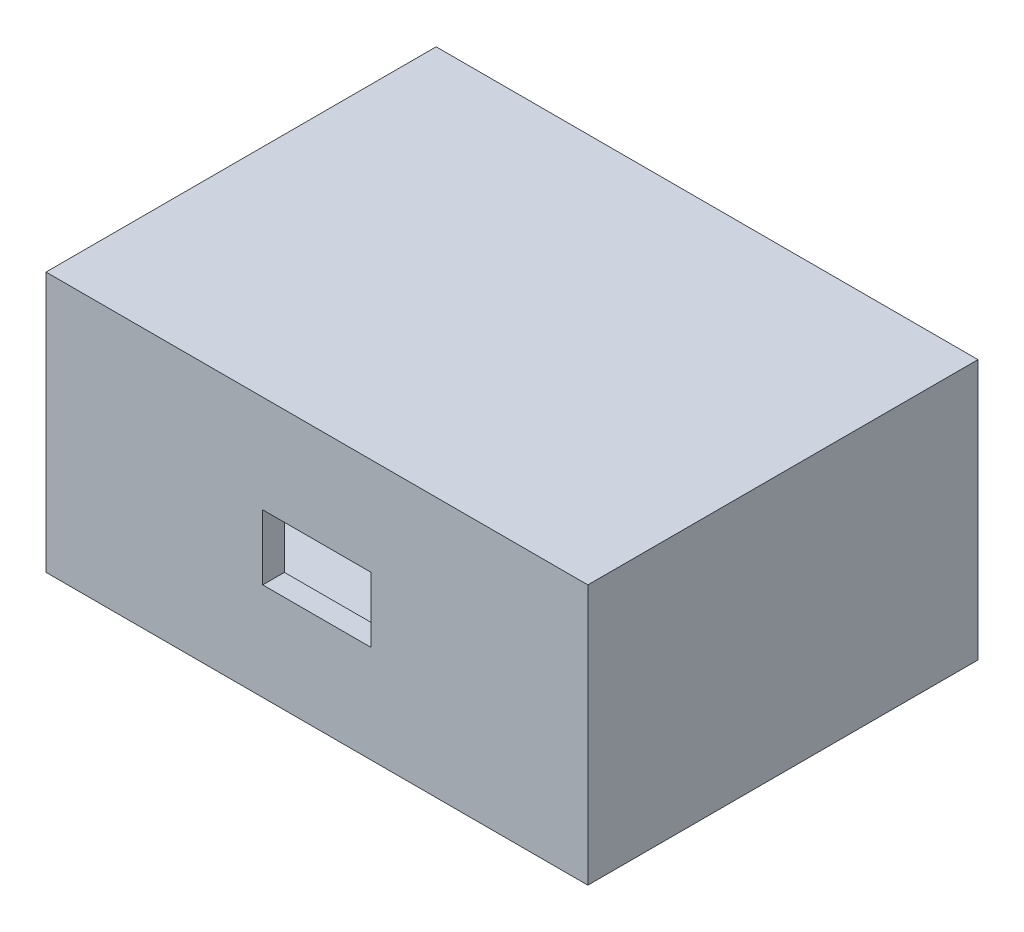
from build123d import *

# Parameters (mm, degrees)
SKETCH1_W           = 50
SKETCH1_H           = 24
BOSS_EXTRUDE1_DEPTH = 36
BOSS_EXTRUDE2_START = -1
SKETCH2_W           = 46
SKETCH2_H           = 20
BOSS_EXTRUDE2_DEPTH = 35
BOSS_EXTRUDE3_START = 33
SKETCH3_W           = 10
SKETCH3_H           = 6
BOSS_EXTRUDE3_DEPTH = 7


with BuildPart() as part:
    # Sketch1 → Boss-Extrude1 (new body)
    with BuildSketch(Plane.XY):
        with Locations((0, 12)):
            Rectangle(SKETCH1_W, SKETCH1_H)
    extrude(amount=BOSS_EXTRUDE1_DEPTH)


with BuildPart() as body_2:
    # Sketch2 → Boss-Extrude2 (new body)
    with BuildSketch(Plane.XY.offset(BOSS_EXTRUDE2_START)):
        with Locations((0, 12)):
            Rectangle(SKETCH2_W, SKETCH2_H)
    extrude(amount=BOSS_EXTRUDE2_DEPTH)


with BuildPart() as part_1:
    add(part.part)

    # Combine1: cut body 2
    add(body_2.part, mode=Mode.SUBTRACT)


with BuildPart() as body_2_2:
    # Sketch3 → Boss-Extrude3 (new body)
    with BuildSketch(Plane.XY.offset(BOSS_EXTRUDE3_START)):
        with Locations((0, 12)):
            Rectangle(SKETCH3_W, SKETCH3_H)
    extrude(amount=BOSS_EXTRUDE3_DEPTH)


with BuildPart() as part_2:
    add(part_1.part)

    # Combine2: cut body 2 2
    add(body_2_2.part, mode=Mode.SUBTRACT)


solid = part_2.part
